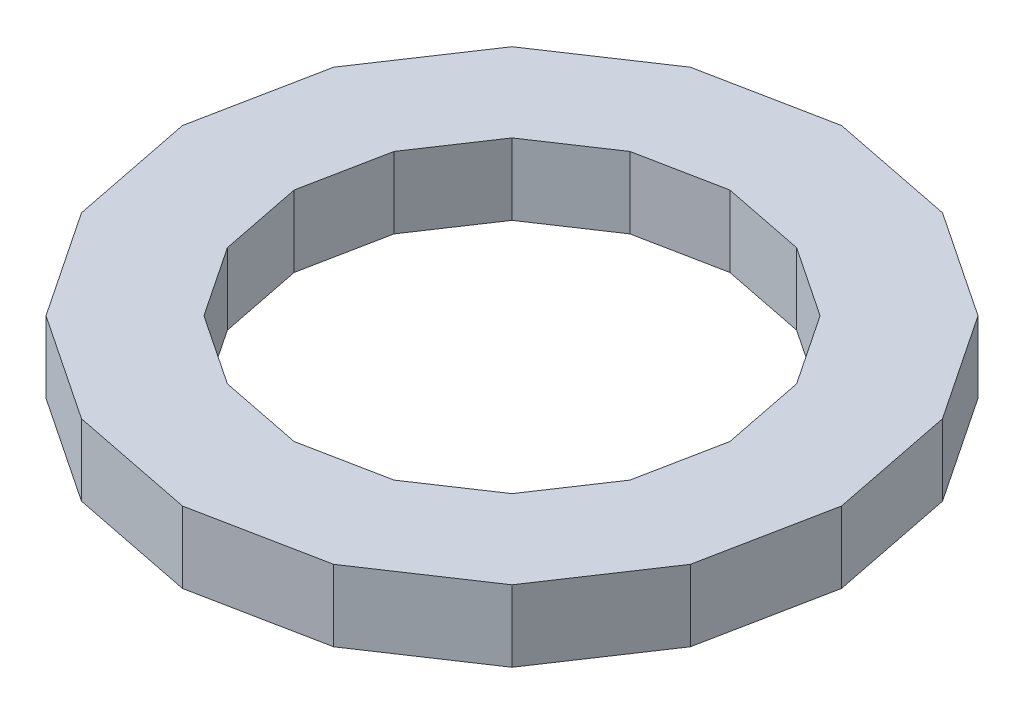
from build123d import *

# Parameters (mm, degrees)
BOSS_EXTRUDE1_DEPTH = 19.05


with BuildPart() as part:
    # Sketch1 → Boss-Extrude1 (new body)
    with BuildSketch(Plane(origin=(0, 0, 0), x_dir=(1, 0, 0), z_dir=(0, 1, 0))):
        Polygon((87.882370703, 0), (81.192723561, 33.631127265), (62.142220271, 62.142220271), (33.631127265, 81.192723561), (0, 87.882370703), (-33.631127265, 81.192723561), (-62.142220271, 62.142220271), (-81.192723561, 33.631127265), (-87.882370703, 0), (-81.192723561, -33.631127265), (-62.142220271, -62.142220271), (-33.631127265, -81.192723561), (0, -87.882370703), (33.631127265, -81.192723561), (62.142220271, -62.142220271), (81.192723561, -33.631127265), align=None)
        Polygon((58.100112972, 0), (53.677505211, 22.233950653), (41.08298387, 41.08298387), (22.233950653, 53.677505211), (0, 58.100112972), (-22.233950653, 53.677505211), (-41.08298387, 41.08298387), (-53.677505211, 22.233950653), (-58.100112972, 0), (-53.677505211, -22.233950653), (-41.08298387, -41.08298387), (-22.233950653, -53.677505211), (0, -58.100112972), (22.233950653, -53.677505211), (41.08298387, -41.08298387), (53.677505211, -22.233950653), align=None, mode=Mode.SUBTRACT)
    extrude(amount=BOSS_EXTRUDE1_DEPTH)


solid = part.part
